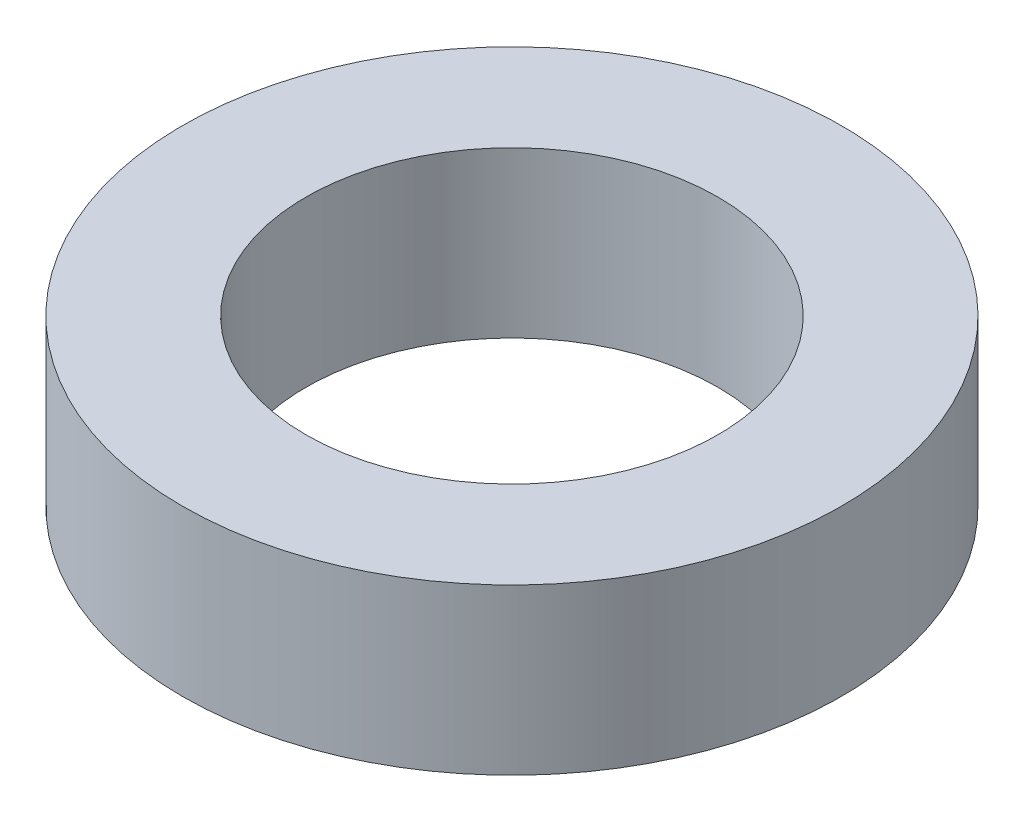
from build123d import *

# Parameters (mm, degrees)
SKETCH1_R           = 6.35
SKETCH1_R_2         = 3.96875
BOSS_EXTRUDE1_DEPTH = 3.175


with BuildPart() as part:
    # Sketch1 → Boss-Extrude1 (new body)
    with BuildSketch(Plane(origin=(0, 0, 0), x_dir=(1, 0, 0), z_dir=(0, 1, 0))):
        Circle(SKETCH1_R)
        Circle(SKETCH1_R_2, mode=Mode.SUBTRACT)
    extrude(amount=BOSS_EXTRUDE1_DEPTH)


solid = part.part
